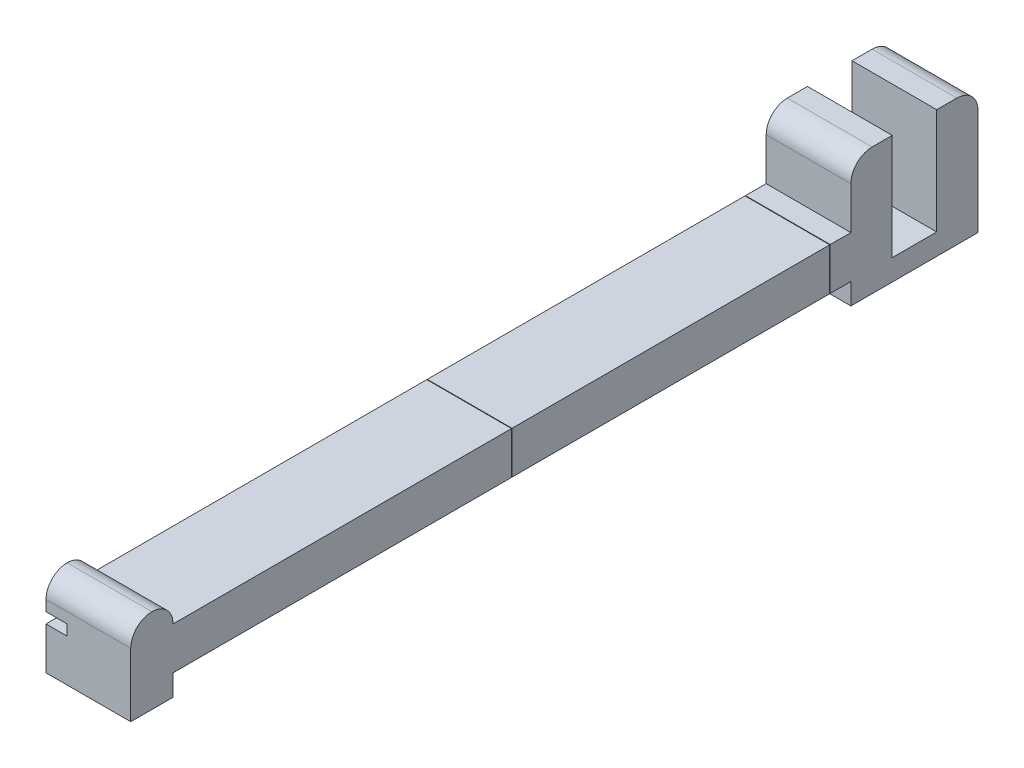
from build123d import *

# Parameters (mm, degrees)
BOSS_EXTRUDE1_DEPTH        = 40
FILLET1_R                  = 10
FILLET2_R                  = 10
SKETCH3_W                  = 180
SKETCH3_H                  = 5
CUT_EXTRUDE2_DEPTH         = 10
SKETCH4_W                  = 40
SKETCH4_H                  = 21
CUT_EXTRUDE3_DEPTH         = 50
CROQUIS1_W                 = 10
CROQUIS1_H                 = 5
SALIENTE_EXTRUIR1_DEPTH    = 85
INDENTACI_N1_OUTLINE_W     = 10.48
INDENTACI_N1_OUTLINE_H     = 5.48
INDENTACI_N1_DEPTH         = 10.24
INDENTACI_N1_2_OUTLINE_W   = 10.48
INDENTACI_N1_2_OUTLINE_H   = 5.48
INDENTACI_N1_2_DEPTH       = 0.24
INDENTACI_N2_START         = -160.24
INDENTACI_N2_OUTLINE_W     = 10.48
INDENTACI_N2_OUTLINE_H     = 5.48
INDENTACI_N2_DEPTH         = 10.24
INDENTACI_N2_START_2       = -150.24
INDENTACI_N2_2_OUTLINE_W   = 40
INDENTACI_N2_2_OUTLINE_H   = 20
INDENTACI_N2_2_OUTLINE_W_2 = 10.48
INDENTACI_N2_2_OUTLINE_H_2 = 5.48
INDENTACI_N2_2_DEPTH       = 0.24


# Read off the part's stored shape, not the designer's step: Indentación1, Indentación2
with BuildPart() as part:
    # Sketch2 → Boss-Extrude1 (new body)
    with BuildSketch(Plane(origin=(0, 0, 0), x_dir=(0, 0, -1), z_dir=(1, 0, 0))):
        Polygon((-160, 10), (-160, 20), (-180, 20), (-180, -20), (-160, -20), (-160, -10), (160, -10), (160, -20), (180, -20), (220, -20), (220, 40), (200, 40), (200, -10), (180, -10), (180, 40), (160, 40), (160, 10), align=None)
    extrude(amount=BOSS_EXTRUDE1_DEPTH)

    # Fillet1
    fillet1_edges = [part.edges().sort_by_distance(p)[0] for p in [
        (20, 20, 180),
        (20, 20, 160),
    ]]
    fillet(fillet1_edges, radius=FILLET1_R - 0.0001)  # a hair under: the kernel refuses the full size

    # Fillet2
    fillet2_edges = [part.edges().sort_by_distance(p)[0] for p in [
        (20, 40, -160),
        (20, 40, -220),
    ]]
    fillet(fillet2_edges, radius=FILLET2_R)

    # Sketch3 → Cut-Extrude2 (cut)
    with BuildSketch(Plane.ZY):
        with Locations((90, 2.5)):
            Rectangle(SKETCH3_W, SKETCH3_H)
    extrude(amount=-CUT_EXTRUDE2_DEPTH, mode=Mode.SUBTRACT)

    # Sketch4 → Cut-Extrude3 (cut)
    with BuildSketch(Plane(origin=(0, 40, 0), x_dir=(1, 0, 0), z_dir=(0, 1, 0))):
        with Locations((20, 190)):
            Rectangle(SKETCH4_W, SKETCH4_H)
    extrude(amount=-CUT_EXTRUDE3_DEPTH, mode=Mode.SUBTRACT)


with BuildPart() as body_2:
    # Partir1: the piece on the far side of the plane
    add(part.part)
    split(bisect_by=Plane.XY, keep=Keep.BOTTOM)


with BuildPart() as part_1:
    add(part.part)

    # Partir1
    split(bisect_by=Plane.XY, keep=Keep.TOP)

    # Indentación1 outline → Indentación1 (cut)
    with BuildSketch(Plane.XY):
        with Locations((20, 0)):
            Rectangle(INDENTACI_N1_OUTLINE_W, INDENTACI_N1_OUTLINE_H)
    extrude(amount=INDENTACI_N1_DEPTH, mode=Mode.SUBTRACT)

    # Indentaci_n1 2 outline → Indentaci_n1 2 (cut)
    with BuildSketch(Plane.XY):
        Polygon((0, -10), (40, -10), (40, 10), (0, 10), (0, 5), (10, 5), (10, 0), (0, 0), align=None)
        with Locations((20, 0)):
            Rectangle(INDENTACI_N1_2_OUTLINE_W, INDENTACI_N1_2_OUTLINE_H, mode=Mode.SUBTRACT)
    extrude(amount=INDENTACI_N1_2_DEPTH, mode=Mode.SUBTRACT)


with BuildPart() as body_3:
    # Partir2: the piece on the far side of the plane
    add(body_2.part)
    split(bisect_by=Plane.XY.offset(-150), keep=Keep.BOTTOM)

    # Indentación2 outline → Indentación2 (cut)
    with BuildSketch(Plane.XY.offset(INDENTACI_N2_START)):
        with Locations((20, 0)):
            Rectangle(INDENTACI_N2_OUTLINE_W, INDENTACI_N2_OUTLINE_H)
    extrude(amount=INDENTACI_N2_DEPTH, mode=Mode.SUBTRACT)

    # Indentaci_n2 2 outline → Indentaci_n2 2 (cut)
    with BuildSketch(Plane.XY.offset(INDENTACI_N2_START_2)):
        with Locations((20, 0)):
            Rectangle(INDENTACI_N2_2_OUTLINE_W, INDENTACI_N2_2_OUTLINE_H)
        with Locations((20, 0)):
            Rectangle(INDENTACI_N2_2_OUTLINE_W_2, INDENTACI_N2_2_OUTLINE_H_2, mode=Mode.SUBTRACT)
    extrude(amount=INDENTACI_N2_2_DEPTH, mode=Mode.SUBTRACT)


with BuildPart() as body_2_1:
    add(body_2.part)

    # Partir2
    split(bisect_by=Plane.XY.offset(-150), keep=Keep.TOP)

    # Croquis1 → Saliente-Extruir1 (add, symmetric)
    with BuildSketch(Plane.XY.offset(-75)):
        with Locations((20, 0)):
            Rectangle(CROQUIS1_W, CROQUIS1_H)
    extrude(amount=SALIENTE_EXTRUIR1_DEPTH, both=True)


solid = Compound([part_1.part, body_3.part, body_2_1.part])
